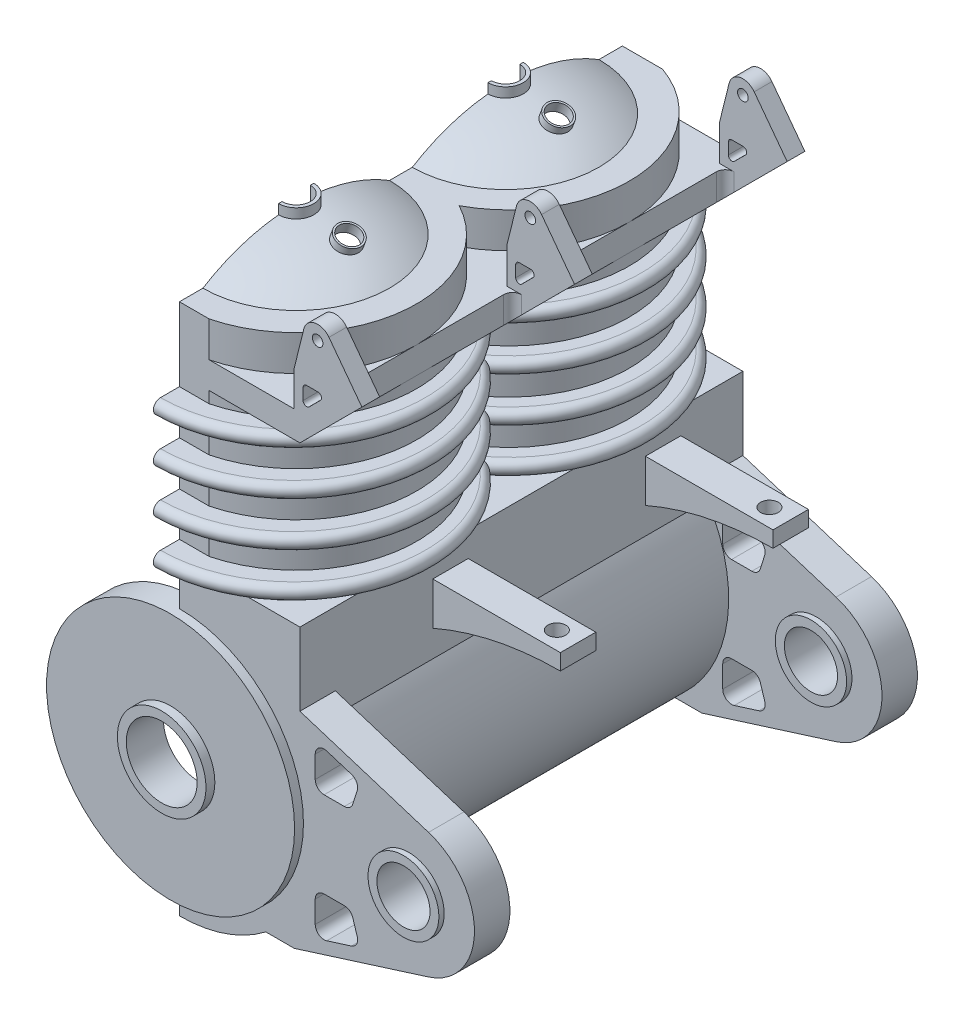
from build123d import *

# Parameters (mm, degrees)
BOSS_EXTRUDE1_DEPTH       = 25
SKETCH2_R                 = 5
CUT_EXTRUDE1_DEPTH        = 20
SKETCH3_R                 = 7
CUT_EXTRUDE2_DEPTH        = 30
CUT_EXTRUDE3_DEPTH        = 9
REVOLVE1_ANGLE            = 156
BOSS_EXTRUDE2_START       = -1
SKETCH12_R                = 7.014347074
SKETCH12_R_2              = 2.5
BOSS_EXTRUDE2_DEPTH       = 1.5
BOSS_EXTRUDE3_DEPTH       = 0.5
BOSS_EXTRUDE3_DEPTH_BACK  = 1
SKETCH13_R                = 7
SKETCH13_R_2              = 2.5
LPATTERN2_COUNT           = 2
LPATTERN2_PITCH           = 12
BOSS_EXTRUDE4_START       = -1.6
SKETCH14_R                = 2.5
SKETCH14_R_2              = 2
BOSS_EXTRUDE4_DEPTH       = 2.1
LPATTERN3_START           = 11.22
LPATTERN3_OUTLINE_R       = 2.5
LPATTERN3_OUTLINE_R_2     = 2
LPATTERN3_DEPTH           = 2.1
BOSS_EXTRUDE5_DEPTH       = 0.5
BOSS_EXTRUDE5_DEPTH_BACK  = 1.6
SKETCH15_R                = 2.5
SKETCH15_R_2              = 2
BOSS_EXTRUDE6_DEPTH       = 2
SKETCH19_R                = 2.013
BOSS_EXTRUDE7_DEPTH       = 2.5
SKETCH20_R                = 2.013
CUT_EXTRUDE4_DEPTH        = 0.5
BOSS_EXTRUDE8_DEPTH       = 0.3
BOSS_EXTRUDE8_DEPTH_BACK  = 2.3
SKETCH21_R                = 2.013
SKETCH21_R_2              = 1.5
SKETCH28_R                = 2
SKETCH28_R_2              = 1.5
BOSS_EXTRUDE11_DEPTH      = 2
BOSS_EXTRUDE12_DEPTH      = 0.3
BOSS_EXTRUDE12_DEPTH_BACK = 2.3
SKETCH29_R                = 2
SKETCH29_R_2              = 1.5
CUT_EXTRUDE5_DEPTH        = 46.64090579
REVOLVE8_ANGLE            = 180
SKETCH35_R                = 0.995
CUT_EXTRUDE6_DEPTH        = 44.820794491
BOSS_EXTRUDE13_START      = 1.2
BOSS_EXTRUDE13_DEPTH      = 0.8
SKETCH37_R                = 0.6
CUT_EXTRUDE7_DEPTH        = 45.150983873
SKETCH39_R                = 0.3
BOSS_EXTRUDE14_DEPTH      = 1
LPATTERN5_COUNT           = 3
LPATTERN5_PITCH           = 12
FILLET1_R                 = 0.5
BOSS_EXTRUDE15_START      = -5.5
BOSS_EXTRUDE15_DEPTH      = 2
LPATTERN6_COUNT           = 2
LPATTERN6_PITCH           = 12
SKETCH41_R                = 0.5
CUT_EXTRUDE8_DEPTH        = 36.761935487
SKETCH42_W                = 5.181283797
SKETCH42_H                = 2.590641898
CUT_EXTRUDE9_DEPTH        = 48.091084211
SKETCH43_R                = 0.3
BOSS_EXTRUDE16_DEPTH      = 1
LPATTERN8_COUNT           = 3
LPATTERN8_PITCH           = 12
EXTRUDE_THIN1_START       = 1.9
SKETCH37_3_R              = 0.7
SKETCH37_3_R_2            = 0.6
EXTRUDE_THIN1_DEPTH       = 0.5


with BuildPart() as part:
    # Sketch1 → Boss-Extrude1 (new body)
    with BuildSketch(Plane.XY):
        with BuildLine():
            Line((-4.029439646, 30.619482599), (-10.829439646, 30.619482599))
            Line((-10.829439646, 30.619482599), (-10.829439646, 2.599482599))
            ThreePointArc((-10.829439646, 2.599482599), (-3.839658104, 6.708087734), (-4.029439646, 14.8137441))
            Line((-4.029439646, 14.8137441), (-4.029439646, 30.619482599))
        make_face()
    extrude(amount=BOSS_EXTRUDE1_DEPTH)

    # Sketch2 → Cut-Extrude1 (cut)
    with BuildSketch(Plane(origin=(0, 30.619482599, 0), x_dir=(1, 0, 0), z_dir=(0, 1, 0))):
        with Locations((-10.829439646, -6.41)):
            Circle(SKETCH2_R)
        with Locations((-10.829439646, -18.41)):
            Circle(SKETCH2_R)
    extrude(amount=-CUT_EXTRUDE1_DEPTH, mode=Mode.SUBTRACT)

    # Sketch3 → Cut-Extrude2 (cut)
    with BuildSketch(Plane.XY.offset(25)):
        with Locations((-10.829439646, 10.619482599)):
            Circle(SKETCH3_R)
    extrude(amount=-CUT_EXTRUDE2_DEPTH, mode=Mode.SUBTRACT)

    # Sketch6 → Cut-Extrude3 (cut)
    with BuildSketch(Plane(origin=(0, 29.119482599, 0), x_dir=(1, 0, 0), z_dir=(0, 1, 0))):
        with BuildLine():
            Line((-10.829439646, -25.21), (-1.630694435, -25.21))
            Line((-1.630694435, -25.21), (-1.630694435, 0.39))
            Line((-1.630694435, 0.39), (-10.829439646, 0.39))
            ThreePointArc((-10.829439646, 0.39), (-4.232470645, -4.76075775), (-7.629439646, -12.41))
            ThreePointArc((-7.629439646, -12.41), (-4.232470645, -20.05924225), (-10.829439646, -25.21))
        make_face()
    extrude(amount=-CUT_EXTRUDE3_DEPTH, mode=Mode.SUBTRACT)

    # Sketch7 → Revolve1 (revolve)
    with BuildSketch(Plane.ZY.offset(10.829439646)):
        Polygon((0.175, 19.769482599), (0.68, 19.769482599), (0.68, 29.769482599), (0.175, 29.769482599), (0.175, 28.469482599), (0, 28.469482599), (0, 27.669482599), (0.175, 27.669482599), (0.175, 25.969482599), (0, 25.969482599), (0, 25.169482599), (0.175, 25.169482599), (0.175, 23.469482599), (0, 23.469482599), (0, 22.669482599), (0.175, 22.669482599), (0.175, 21.008109805), (0, 21.008109805), (0, 20.208109805), (0.175, 20.208109805), align=None)
        with BuildLine():
            Line((-1.07, 22.669482599), (0, 22.669482599))
            Line((0, 22.669482599), (0, 23.469482599))
            Line((0, 23.469482599), (-1.07, 23.469482599))
            ThreePointArc((-1.07, 23.469482599), (-1.47, 23.069482599), (-1.07, 22.669482599))
        make_face()
        with BuildLine():
            Line((-1.07, 20.208109805), (0, 20.208109805))
            Line((0, 20.208109805), (0, 21.008109805))
            Line((0, 21.008109805), (-1.07, 21.008109805))
            ThreePointArc((-1.07, 21.008109805), (-1.47, 20.608109805), (-1.07, 20.208109805))
        make_face()
        with BuildLine():
            Line((0, 25.169482599), (0, 25.969482599))
            Line((0, 25.969482599), (-1.07, 25.969482599))
            ThreePointArc((-1.07, 25.969482599), (-1.47, 25.569482599), (-1.07, 25.169482599))
            Line((-1.07, 25.169482599), (0, 25.169482599))
        make_face()
        with BuildLine():
            Line((0, 27.669482599), (0, 28.469482599))
            Line((0, 28.469482599), (-1.07, 28.469482599))
            ThreePointArc((-1.07, 28.469482599), (-1.47, 28.069482599), (-1.07, 27.669482599))
            Line((-1.07, 27.669482599), (0, 27.669482599))
        make_face()
    revolve1 = revolve(axis=Axis((-10.829439646, 30.619482599, 6.41), (0, -1, 0)), revolution_arc=REVOLVE1_ANGLE)

    # Mirror1: Revolve1 across plane
    add(revolve1.mirror(Plane.XY.offset(12.5)))

    # Sketch13 → Boss-Extrude3 (add, two sides: drawn at the far end of the back side and taken through both)
    with BuildSketch(Plane.XY.offset(25).offset(-BOSS_EXTRUDE3_DEPTH_BACK)):
        with Locations((-10.829439646, 10.619482599)):
            Circle(SKETCH13_R)
        with Locations(Location((-10.829439646, 10.619482599, 0), (0, 0, 180))):
            Circle(SKETCH13_R_2, mode=Mode.SUBTRACT)
    extrude(amount=BOSS_EXTRUDE3_DEPTH + BOSS_EXTRUDE3_DEPTH_BACK)


with BuildPart() as body_2:
    # Sketch12 → Boss-Extrude2 (new body)
    with BuildSketch(Plane(origin=(0, 0, 0), x_dir=(-1, 0, 0), z_dir=(0, 0, -1)).offset(BOSS_EXTRUDE2_START)):
        with Locations((10.829439646, 10.619482599)):
            Circle(SKETCH12_R)
        with Locations((10.829439646, 10.619482599)):
            Circle(SKETCH12_R_2, mode=Mode.SUBTRACT)
    boss_extrude2 = extrude(amount=BOSS_EXTRUDE2_DEPTH)


    add(part.part)  # Boss-Extrude4 merges part
    # Sketch14 → Boss-Extrude4 (add)
    with BuildSketch(Plane(origin=(0, 0, -0.5), x_dir=(-1, 0, 0), z_dir=(0, 0, -1)).offset(BOSS_EXTRUDE4_START)):
        with Locations((10.829439646, 10.619482599)):
            Circle(SKETCH14_R)
        with Locations((10.829439646, 10.619482599)):
            Circle(SKETCH14_R_2, mode=Mode.SUBTRACT)
    extrude(amount=BOSS_EXTRUDE4_DEPTH)


with BuildPart() as lpattern2_1:
    # LPattern2: Boss-Extrude2 ×2
    with Locations(*[(0, 0, i * LPATTERN2_PITCH) for i in range(1, LPATTERN2_COUNT)]):
        add(boss_extrude2)


    add(body_2.part)  # LPattern3 merges body 2
    # LPattern3: read off the stored shape, not the designer's step
    # LPattern3 outline → LPattern3 (add)
    with BuildSketch(Plane.XY.offset(LPATTERN3_START)):
        with Locations((-10.829439646, 10.619482599)):
            Circle(LPATTERN3_OUTLINE_R)
        with Locations((-10.829439646, 10.619482599)):
            Circle(LPATTERN3_OUTLINE_R_2, mode=Mode.SUBTRACT)
    extrude(amount=LPATTERN3_DEPTH)

    # Sketch15 → Boss-Extrude5 (add, two sides: drawn at the far end of the back side and taken through both)
    with BuildSketch(Plane.XY.offset(25.5).offset(-BOSS_EXTRUDE5_DEPTH_BACK)):
        with Locations(Location((-10.829439646, 10.619482599, 0), (0, 0, 180))):
            Circle(SKETCH15_R)
        with Locations(Location((-10.829439646, 10.619482599, 0), (0, 0, 180))):
            Circle(SKETCH15_R_2, mode=Mode.SUBTRACT)
    extrude(amount=BOSS_EXTRUDE5_DEPTH + BOSS_EXTRUDE5_DEPTH_BACK)

    # Sketch16 → Boss-Extrude6 (add)
    with BuildSketch(Plane(origin=(0, 30.619482599, 0), x_dir=(1, 0, 0), z_dir=(0, 1, 0))):
        with BuildLine():
            Line((-10.829439646, -1.41), (-10.829439646, 0))
            Line((-10.829439646, 0), (-8.559659921, 0))
            ThreePointArc((-8.559659921, 0), (-5.276309802, -2.485366395), (-4.029439646, -6.41))
            ThreePointArc((-4.029439646, -6.41), (-4.998487751, -9.908571137), (-7.629439646, -12.41))
            ThreePointArc((-7.629439646, -12.41), (-4.998487751, -14.911428863), (-4.029439646, -18.41))
            ThreePointArc((-4.029439646, -18.41), (-5.460886294, -22.583563813), (-9.152567558, -25))
            Line((-9.152567558, -25), (-10.829439646, -25))
            Line((-10.829439646, -25), (-10.829439646, -23.41))
            ThreePointArc((-10.829439646, -23.41), (-5.829439646, -18.41), (-10.829439646, -13.41))
            Line((-10.829439646, -13.41), (-10.829439646, -11.41))
            ThreePointArc((-10.829439646, -11.41), (-5.829439646, -6.41), (-10.829439646, -1.41))
        make_face()
    extrude(amount=BOSS_EXTRUDE6_DEPTH)

    # Sketch19 → Boss-Extrude7 (add)
    with BuildSketch(Plane(origin=(0, 0, -0.5), x_dir=(-1, 0, 0), z_dir=(0, 0, -1))):
        with BuildLine():
            Line((4.029439646, 16.003575825), (-3.229276752, 13.714911335))
            ThreePointArc((-3.229276752, 13.714911335), (-5.821560354, 10.179482599), (-3.229276752, 6.644053862))
            Line((-3.229276752, 6.644053862), (4.346334119, 4.255472929))
            Line((4.346334119, 4.255472929), (5.955679156, 4.255472929))
            ThreePointArc((5.955679156, 4.255472929), (2.959341583, 9.163670467), (4.029439646, 14.8137441))
            Line((4.029439646, 14.8137441), (4.029439646, 16.003575825))
        make_face()
        with Locations((-2.114560354, 10.179482599)):
            Circle(SKETCH19_R, mode=Mode.SUBTRACT)
    extrude(amount=-BOSS_EXTRUDE7_DEPTH)

    # Sketch20 → Cut-Extrude4 (cut)
    with BuildSketch(Plane(origin=(0, 0, -0.5), x_dir=(-1, 0, 0), z_dir=(0, 0, -1))):
        with BuildLine():
            Line((4.029439646, 14.8137441), (4.029439646, 16.003575825))
            Line((4.029439646, 16.003575825), (-3.229276752, 13.714911335))
            ThreePointArc((-3.229276752, 13.714911335), (-5.821560354, 10.179482599), (-3.229276752, 6.644053862))
            Line((-3.229276752, 6.644053862), (4.346334119, 4.255472929))
            Line((4.346334119, 4.255472929), (5.955679156, 4.255472929))
            ThreePointArc((5.955679156, 4.255472929), (2.959341583, 9.163670467), (4.029439646, 14.8137441))
        make_face()
        with Locations((-2.114560354, 10.179482599)):
            Circle(SKETCH20_R, mode=Mode.SUBTRACT)
    extrude(amount=-CUT_EXTRUDE4_DEPTH, mode=Mode.SUBTRACT)

    # Sketch21 → Boss-Extrude8 (add, two sides: drawn at the far end of the back side and taken through both)
    with BuildSketch(Plane(origin=(0, 0, 0), x_dir=(-1, 0, 0), z_dir=(0, 0, -1)).offset(-BOSS_EXTRUDE8_DEPTH_BACK)):
        with Locations((-2.114560354, 10.179482599)):
            Circle(SKETCH21_R)
        with Locations((-2.114560354, 10.179482599)):
            Circle(SKETCH21_R_2, mode=Mode.SUBTRACT)
    extrude(amount=BOSS_EXTRUDE8_DEPTH + BOSS_EXTRUDE8_DEPTH_BACK)

    # Sketch28 → Boss-Extrude11 (add)
    # profile 1 of 2: a face of its own
    with BuildSketch(Plane.XY.offset(25)):
        with BuildLine():
            Line((3.229276752, 6.644053862), (-4.346334119, 4.255472929))
            Line((-4.346334119, 4.255472929), (-5.955679156, 4.255472929))
            ThreePointArc((-5.955679156, 4.255472929), (-2.959341583, 9.163670467), (-4.029439646, 14.8137441))
            Line((-4.029439646, 14.8137441), (-4.029439646, 16.003575825))
            Line((-4.029439646, 16.003575825), (3.229276752, 13.714911335))
            ThreePointArc((3.229276752, 13.714911335), (5.821560354, 10.179482599), (3.229276752, 6.644053862))
        make_face()
        with Locations((2.114560354, 10.179482599)):
            Circle(SKETCH28_R, mode=Mode.SUBTRACT)
    # profile 2 of 2: a face of its own
    with BuildSketch(Plane.XY.offset(25)):
        with Locations(Location((2.114560354, 10.179482599, 0), (0, 0, 180))):
            Circle(SKETCH28_R_2)
    extrude(amount=-BOSS_EXTRUDE11_DEPTH)


with BuildPart() as boss_extrude11_kept_piece:
    # of the separate pieces the step leaves, the one the design keeps (boss_extrude11_pieces_kept)
    add(lpattern2_1.part.solids().sort_by_distance((-4.029439646, 16.003575825, 0))[0])

    # Sketch29 → Boss-Extrude12 (add, two sides: drawn at the far end of the back side and taken through both)
    with BuildSketch(Plane.XY.offset(25).offset(-BOSS_EXTRUDE12_DEPTH_BACK)):
        with Locations((2.114560354, 10.179482599)):
            Circle(SKETCH29_R)
        with Locations(Location((2.114560354, 10.179482599, 0), (0, 0, 180))):
            Circle(SKETCH29_R_2, mode=Mode.SUBTRACT)
    extrude(amount=BOSS_EXTRUDE12_DEPTH + BOSS_EXTRUDE12_DEPTH_BACK)

    # Sketch31 → Cut-Extrude5 (cut, through all)
    with BuildSketch(Plane(origin=(0, 0, 0), x_dir=(-1, 0, 0), z_dir=(0, 0, -1))):
        with BuildLine():
            Line((1.12095382, 14.377444499), (2.514775184, 14.816914686))
            ThreePointArc((2.514775184, 14.816914686), (2.960782908, 14.743278513), (3.165128084, 14.340056211))
            Line((3.165128084, 14.340056211), (3.165128084, 13.103634568))
            ThreePointArc((3.165128084, 13.103634568), (3.018681474, 12.750081177), (2.665128084, 12.603634568))
            Line((2.665128084, 12.603634568), (1.522584548, 12.603634568))
            ThreePointArc((1.522584548, 12.603634568), (1.226929724, 12.700412266), (1.045726073, 12.953281668))
            Line((1.045726073, 12.953281668), (0.794448245, 13.750233123))
            ThreePointArc((0.794448245, 13.750233123), (0.827801303, 14.13146033), (1.12095382, 14.377444499))
        make_face()
        with BuildLine():
            Line((1.045726073, 7.405683529), (0.794448245, 6.608732074))
            ThreePointArc((0.794448245, 6.608732074), (0.827801303, 6.227504868), (1.12095382, 5.981520699))
            Line((1.12095382, 5.981520699), (2.514775184, 5.542050511))
            ThreePointArc((2.514775184, 5.542050511), (2.960782908, 5.615686684), (3.165128084, 6.018908986))
            Line((3.165128084, 6.018908986), (3.165128084, 7.255330629))
            ThreePointArc((3.165128084, 7.255330629), (3.018681474, 7.60888402), (2.665128084, 7.755330629))
            Line((2.665128084, 7.755330629), (1.522584548, 7.755330629))
            ThreePointArc((1.522584548, 7.755330629), (1.226929724, 7.658552932), (1.045726073, 7.405683529))
        make_face()
    extrude(amount=-CUT_EXTRUDE5_DEPTH, mode=Mode.SUBTRACT)

    # Sketch34 → Revolve8 (revolve)
    with BuildSketch(Plane.ZY.offset(10.829439646)):
        with BuildLine():
            Line((13.142173124, 32.619482599), (13.373691828, 32.619482599))
            ThreePointArc((13.373691828, 32.619482599), (15.799023171, 33.648239076), (18.41, 33.999482599))
            Line((18.41, 33.999482599), (18.41, 34.119482599))
            ThreePointArc((18.41, 34.119482599), (15.671387212, 33.73717463), (13.142173124, 32.619482599))
        make_face()
    revolve8 = revolve(axis=Axis((-10.829439646, 32.619482599, 18.41), (0, -1, 0)), revolution_arc=REVOLVE8_ANGLE)

    # Mirror3: Revolve8 across plane
    add(revolve8.mirror(Plane.XY.offset(12.5)))

    # Sketch35 → Cut-Extrude6 (cut, through all)
    with BuildSketch(Plane(origin=(0, 32.619482599, 0), x_dir=(1, 0, 0), z_dir=(0, 1, 0))):
        with Locations((-10.829439646, -18.41)):
            Circle(SKETCH35_R)
        with Locations((-10.829439646, -6.59)):
            Circle(SKETCH35_R)
    extrude(amount=CUT_EXTRUDE6_DEPTH, mode=Mode.SUBTRACT)

    # Sketch36 → Boss-Extrude13 (add)
    with BuildSketch(Plane(origin=(0, 32.619482599, 0), x_dir=(1, 0, 0), z_dir=(0, 1, 0)).offset(BOSS_EXTRUDE13_START)):
        with BuildLine():
            Line((-10.829439646, -17.415), (-10.829439646, -17.61))
            ThreePointArc((-10.829439646, -17.61), (-10.029439646, -18.41), (-10.829439646, -19.21))
            Line((-10.829439646, -19.21), (-10.829439646, -19.405))
            ThreePointArc((-10.829439646, -19.405), (-9.834439646, -18.41), (-10.829439646, -17.415))
        make_face()
        with BuildLine():
            Line((-10.829439646, -5.595), (-10.829439646, -5.79))
            ThreePointArc((-10.829439646, -5.79), (-10.029439646, -6.59), (-10.829439646, -7.39))
            Line((-10.829439646, -7.39), (-10.829439646, -7.585))
            ThreePointArc((-10.829439646, -7.585), (-9.834439646, -6.59), (-10.829439646, -5.595))
        make_face()
    extrude(amount=BOSS_EXTRUDE13_DEPTH)

    # Sketch37 → Cut-Extrude7 (cut, through all)
    with BuildSketch(Plane(origin=(9.216895833, 25.323213178, 0), x_dir=(0, 0, 1), z_dir=(0.34202014332565694, 0.9396926207859128, -9.423514657359874e-15))):
        with Locations(Location((18.41, -19.016904923, 0), (0, 0, 232.601339162))):
            Circle(SKETCH37_R)
        with Locations(Location((6.59, -19.016904923, 0), (0, 0, 232.601339162))):
            Circle(SKETCH37_R)
    extrude(amount=CUT_EXTRUDE7_DEPTH, mode=Mode.SUBTRACT)

    # Sketch39 → Boss-Extrude14 (add)
    with BuildSketch(Plane.XY.offset(25)):
        with BuildLine():
            Line((-4.029439646, 30.619482599), (-4.029439646, 29.119482599))
            Line((-4.029439646, 29.119482599), (-0.155606676, 32.994249193))
            ThreePointArc((-0.155606676, 32.994249193), (-0.155606676, 33.743782381), (-0.905139864, 33.743782381))
            Line((-0.905139864, 33.743782381), (-2.029439646, 32.619482599))
            Line((-2.029439646, 32.619482599), (-4.349439646, 32.619482599))
            Line((-4.349439646, 32.619482599), (-4.349439646, 30.619482599))
            Line((-4.349439646, 30.619482599), (-4.029439646, 30.619482599))
        make_face()
        with BuildLine():
            ThreePointArc((-3.012282359, 32.119482599), (-2.827506452, 31.996019285), (-2.870861003, 31.778061243))
            Line((-2.870861003, 31.778061243), (-3.50801829, 31.140903955))
            ThreePointArc((-3.50801829, 31.140903955), (-3.725976333, 31.097549405), (-3.849439646, 31.282325311))
            Line((-3.849439646, 31.282325311), (-3.849439646, 31.919482599))
            ThreePointArc((-3.849439646, 31.919482599), (-3.790861003, 32.060903955), (-3.649439646, 32.119482599))
            Line((-3.649439646, 32.119482599), (-3.012282359, 32.119482599))
        make_face(mode=Mode.SUBTRACT)
        with Locations((-0.53037327, 33.369015787)):
            Circle(SKETCH39_R, mode=Mode.SUBTRACT)
    boss_extrude14 = extrude(amount=-BOSS_EXTRUDE14_DEPTH)

    # LPattern5: Boss-Extrude14 ×3
    with Locations(*[(0, 0, -i * LPATTERN5_PITCH) for i in range(1, LPATTERN5_COUNT)]):
        add(boss_extrude14)

    # Fillet1
    fillet1_edges = [boss_extrude11_kept_piece.edges().sort_by_distance(p)[0] for p in [
        (-4.029439646, 29.869482599, 24),
        (-4.029439646, 29.869482599, 13),
        (-4.029439646, 29.869482599, 12),
        (-4.029439646, 29.869482599, 1),
    ]]
    fillet(fillet1_edges, radius=FILLET1_R)

    # Boss-Extrude15: read off the stored shape, not the designer's step
    # Boss-Extrude15 outline → Boss-Extrude15 (add)
    with BuildSketch(Plane(origin=(0, 0, 0), x_dir=(-1, 0, 0), z_dir=(0, 0, -1)).offset(BOSS_EXTRUDE15_START)):
        with BuildLine():
            Line((4.029439646, 18.719482599), (-3.170560354, 18.719482599))
            Line((-3.170560354, 18.719482599), (-3.170560354, 17.819482599))
            ThreePointArc((-3.170560354, 17.819482599), (0.507480653, 17.438617875), (4.029439646, 16.312186148))
            Line((4.029439646, 16.312186148), (4.029439646, 18.719482599))
        make_face()
    boss_extrude15 = extrude(amount=BOSS_EXTRUDE15_DEPTH)

    # LPattern6: Boss-Extrude15 ×2
    with Locations(*[(0, 0, i * LPATTERN6_PITCH) for i in range(1, LPATTERN6_COUNT)]):
        add(boss_extrude15)

    # Sketch41 → Cut-Extrude8 (cut, through all)
    with BuildSketch(Plane(origin=(0, 18.719482599, 0), x_dir=(1, 0, 0), z_dir=(0, 1, 0))):
        with Locations(Location((1.970560354, -4.5, 0), (0, 0, 270))):
            Circle(SKETCH41_R)
        with Locations(Location((1.970560354, -16.5, 0), (0, 0, 270))):
            Circle(SKETCH41_R)
    extrude(amount=-CUT_EXTRUDE8_DEPTH, mode=Mode.SUBTRACT)

    # Sketch42 → Cut-Extrude9 (cut, through all)
    with BuildSketch(Plane(origin=(0, 0, 0), x_dir=(-1, 0, 0), z_dir=(0, 0, -1))):
        with Locations((1.527375719, 33.914803548)):
            Rectangle(SKETCH42_W, SKETCH42_H)
    extrude(amount=-CUT_EXTRUDE9_DEPTH, mode=Mode.SUBTRACT)

    # Sketch43 → Boss-Extrude16 (add)
    with BuildSketch(Plane(origin=(0, 0, 0), x_dir=(-1, 0, 0), z_dir=(0, 0, -1))):
        with BuildLine():
            Line((4.349439646, 32.619482599), (3.805937073, 34.8119709))
            ThreePointArc((3.805937073, 34.8119709), (3.188488319, 35.403512904), (2.389335178, 35.099343276))
            Line((2.389335178, 35.099343276), (0.53028297, 32.619482599))
            Line((0.53028297, 32.619482599), (4.349439646, 32.619482599))
        make_face()
        with Locations((3.029439646, 34.619482599)):
            Circle(SKETCH43_R, mode=Mode.SUBTRACT)
    boss_extrude16 = extrude(amount=-BOSS_EXTRUDE16_DEPTH)

    # LPattern8: Boss-Extrude16 ×3
    with Locations(*[(0, 0, i * LPATTERN8_PITCH) for i in range(1, LPATTERN8_COUNT)]):
        add(boss_extrude16)

    # Sketch37<3> → Extrude-Thin1 (add)
    # profile 1 of 2: a face of its own
    with BuildSketch(Plane(origin=(9.216895833, 25.323213178, 0), x_dir=(0, 0, 1), z_dir=(0.34202014332565694, 0.9396926207859128, -9.423514657359874e-15)).offset(EXTRUDE_THIN1_START)):
        with Locations((18.41, -19.016904923)):
            Circle(SKETCH37_3_R)
        with Locations((18.41, -19.016904923)):
            Circle(SKETCH37_3_R_2, mode=Mode.SUBTRACT)
    # profile 2 of 2: a face of its own
    with BuildSketch(Plane(origin=(9.216895833, 25.323213178, 0), x_dir=(0, 0, 1), z_dir=(0.34202014332565694, 0.9396926207859128, -9.423514657359874e-15)).offset(EXTRUDE_THIN1_START)):
        with Locations((6.59, -19.016904923)):
            Circle(SKETCH37_3_R)
        with Locations((6.59, -19.016904923)):
            Circle(SKETCH37_3_R_2, mode=Mode.SUBTRACT)
    extrude(amount=EXTRUDE_THIN1_DEPTH)


solid = boss_extrude11_kept_piece.part
